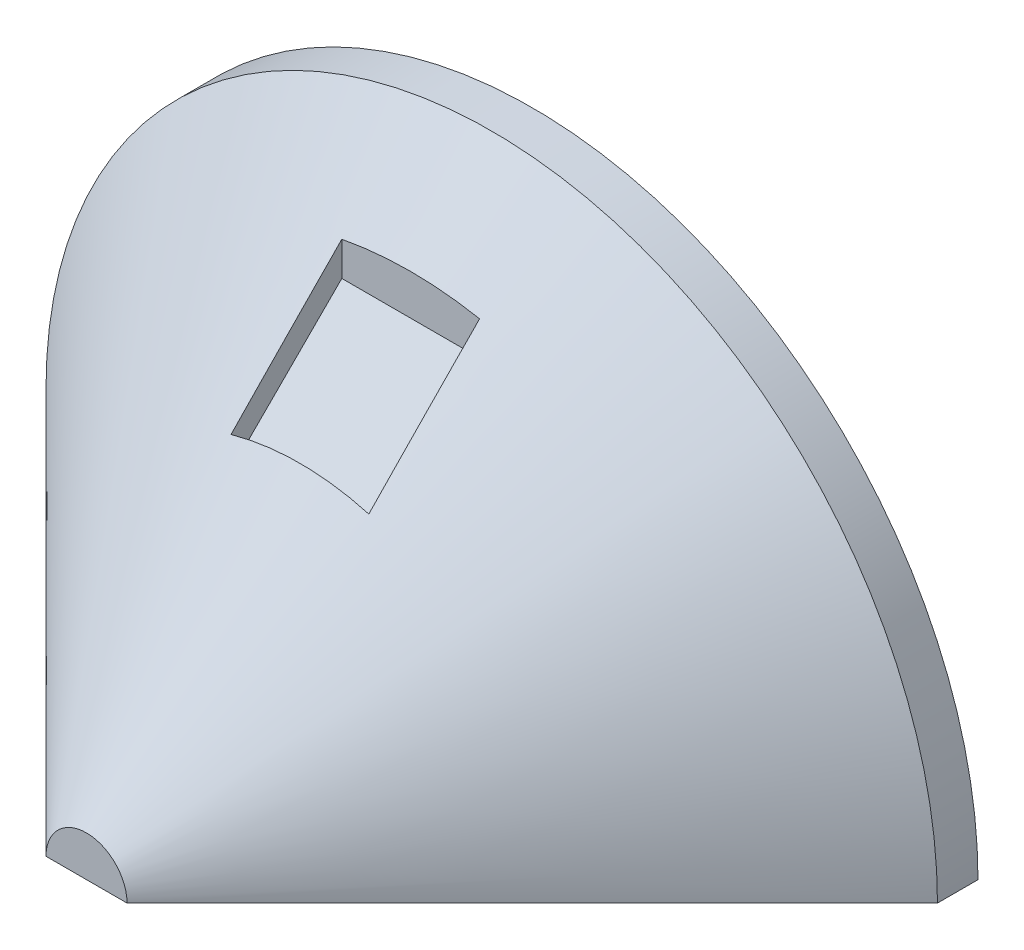
from build123d import *

# Parameters (mm, degrees)
REVOLVE2_ANGLE          = 180
CUT_EXTRUDE1_DEPTH      = 6.477
CUT_EXTRUDE1_DEPTH_BACK = 6.477


# Read off the part's stored shape, not the designer's step: Revolve2
with BuildPart() as part:
    # Revolve2 outline → Revolve2 (revolve)
    with BuildSketch(Plane.XZ):
        Polygon((3.81, 0), (0, 0), (0, -3.81), (38.1, -41.91), (41.91, -41.91), (41.91, -38.1), align=None)
    revolve(axis=Axis((0, 0, 0), (0, 0, 1)), revolution_arc=REVOLVE2_ANGLE)

    # Sketch6 → Cut-Extrude1 (cut, two sides: drawn at the far end of the back side and taken through both)
    with BuildSketch(Plane(origin=(0, 0, 0), x_dir=(0, 0, -1), z_dir=(1, 0, 0)).offset(-CUT_EXTRUDE1_DEPTH_BACK)):
        Polygon((20.066, 20.066), (20.066, 29.318948776), (20.066, 36.223650293), (30.48, 36.223650293), (30.48, 30.48), align=None)
    extrude(amount=CUT_EXTRUDE1_DEPTH + CUT_EXTRUDE1_DEPTH_BACK, mode=Mode.SUBTRACT)


solid = part.part
